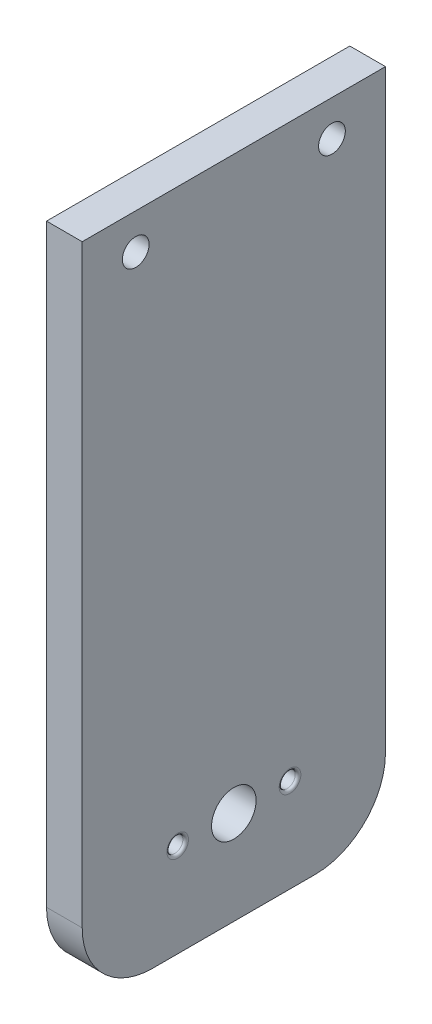
from build123d import *

# Parameters (mm, degrees)
SKETCH1_W           = 107.95
SKETCH1_H           = 236.535
SKETCH1_R           = 7.94
SKETCH1_R_2         = 2.86
SKETCH1_R_3         = 4.7625
BOSS_EXTRUDE1_DEPTH = 12.7
FILLET1_R           = 25
FILLET2_R           = 1


with BuildPart() as part:
    # Sketch1 → Boss-Extrude1 (new body)
    with BuildSketch(Plane(origin=(0, 0, 0), x_dir=(0, 0, -1), z_dir=(1, 0, 0))):
        Rectangle(SKETCH1_W, SKETCH1_H)
        with Locations((0, -84.9275)):
            Circle(SKETCH1_R, mode=Mode.SUBTRACT)
        with Locations((20, -84.9275)):
            Circle(SKETCH1_R_2, mode=Mode.SUBTRACT)
        with Locations((-20, -84.9275)):
            Circle(SKETCH1_R_2, mode=Mode.SUBTRACT)
        with Locations((-34.925, 105.5675)):
            Circle(SKETCH1_R_3, mode=Mode.SUBTRACT)
        with Locations((34.925, 105.5675)):
            Circle(SKETCH1_R_3, mode=Mode.SUBTRACT)
    extrude(amount=BOSS_EXTRUDE1_DEPTH)

    # Fillet1
    fillet1_edges = [part.edges().sort_by_distance(p)[0] for p in [
        (6.35, -118.2675, 53.975),
        (6.35, -118.2675, -53.975),
    ]]
    fillet(fillet1_edges, radius=FILLET1_R)

    # Fillet2
    fillet2_edges = [part.edges().sort_by_distance(p)[0] for p in [
        (12.7, -84.9275, -17.14),
        (0, -84.9275, -17.14),
        (12.7, -84.9275, 22.86),
        (0, -84.9275, 22.86),
    ]]
    fillet(fillet2_edges, radius=FILLET2_R)


solid = part.part
